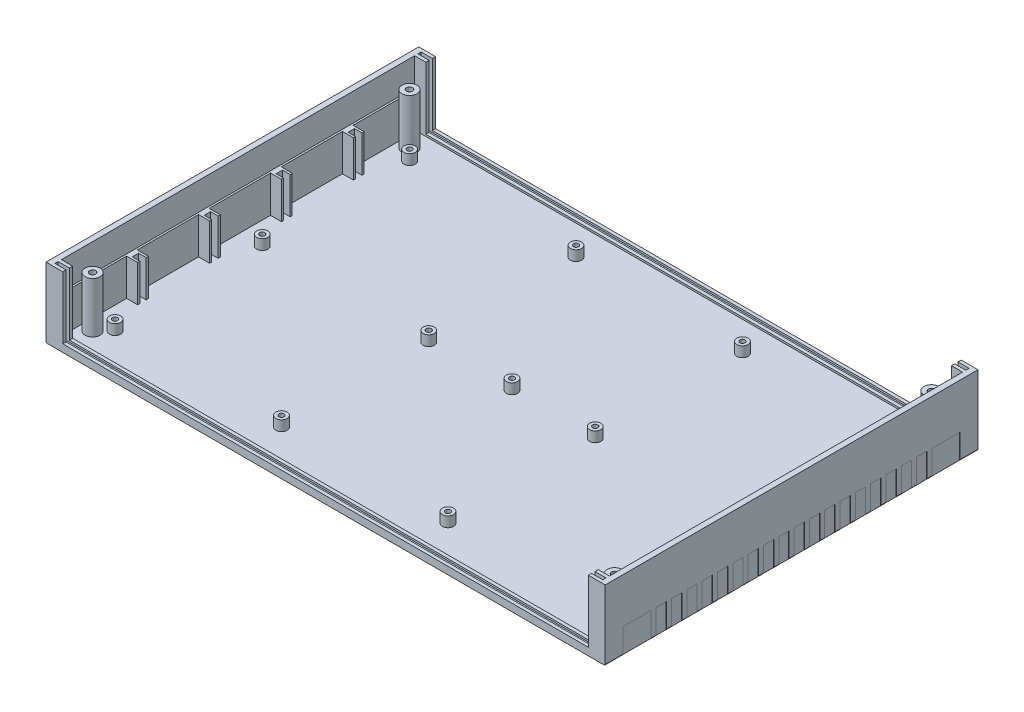
from build123d import *

# Parameters (mm, degrees)
BOSS_EXTRUDE1_DEPTH        = 200
BOSS_EXTRUDE2_DEPTH        = 1.75
BOSS_EXTRUDE3_DEPTH        = 1.75
BOSS_EXTRUDE4_DEPTH        = 19.673598
SKETCH6_R                  = 3
BOSS_EXTRUDE5_DEPTH        = 5.5
SKETCH7_R                  = 4
SKETCH7_R_2                = 1.65
BOSS_EXTRUDE6_DEPTH        = 27.21
SKETCH8_W                  = 5.5555
SKETCH8_H                  = 13.3332
CUT_EXTRUDE1_DEPTH         = 0.2
SKETCH9_W                  = 13.3332
SKETCH9_H                  = 15
SKETCH9_H_2                = 5.5555
CUT_EXTRUDE2_DEPTH         = 0.2
SKETCH10_R                 = 3.143429844
CUT_EXTRUDE3_DEPTH         = 0.2
DOME1_FACE_RADIUS          = 3.143429844
DOME1_HEIGHT               = 2
DOME2_FACE_RADIUS          = 3.143429844
DOME2_HEIGHT               = 2
MIRROR3_COPY_1_FACE_RADIUS = 3.143429844
MIRROR3_COPY_1_HEIGHT      = 2
MIRROR3_COPY_2_FACE_RADIUS = 3.143429844
MIRROR3_COPY_2_HEIGHT      = 2
FILLET1_R                  = 0.6
FILLET2_R                  = 0.6
SKETCH12_W                 = 9
SKETCH12_H                 = 1.75
BOSS_EXTRUDE7_DEPTH        = 34.5
SKETCH13_W                 = 3
SKETCH13_H                 = 200
BOSS_EXTRUDE8_DEPTH        = 19.5


with BuildPart() as part:
    # Sketch1 → Boss-Extrude1 (new body)
    with BuildSketch(Plane.XY):
        Polygon((-159.663258025, 326.785455425), (-161.585000523, 324.985383622), (-161.585000523, 305.311785148), (-171.635000523, 305.311785148), (-173.235000523, 305.311785148), (-176.035000523, 305.311785148), (-177.635000523, 305.311785148), (-183.826313644, 305.311785148), (-260.935000523, 305.311785148), (-262.535000523, 305.311785148), (-265.335000523, 305.311785148), (-266.935000523, 305.311785148), (-305.585000523, 305.311785148), (-307.185000523, 305.311785148), (-309.985000523, 305.311785148), (-311.585000523, 305.311785148), (-350.235000523, 305.311785148), (-351.835000523, 305.311785148), (-354.635000523, 305.311785148), (-356.235000523, 305.311785148), (-439.535000523, 305.311785148), (-441.135000523, 305.311785148), (-443.935000523, 305.311785148), (-445.535000523, 305.311785148), (-455.585000523, 305.311785148), (-455.585000523, 324.985383622), (-457.506743022, 326.785455425), (-458.585000523, 326.353786405), (-458.585000523, 323.212628261), (-458.585000523, 302.311785148), (-158.585000523, 302.311785148), (-158.585000523, 323.212628261), (-158.585000523, 326.353786405), align=None)
    extrude(amount=BOSS_EXTRUDE1_DEPTH)

    # Sketch3 → Boss-Extrude2 (add)
    with BuildSketch(Plane.XY.offset(200)):
        Polygon((-266.935000523, 306.311785148), (-305.585000523, 306.311785148), (-356.235000523, 306.311785148), (-449.585000523, 306.311785148), (-449.585000523, 323.968191865), (-451.320507928, 325.313818993), (-452.793420583, 322.37054613), (-455.585000523, 324.985383622), (-455.585000523, 305.311785148), (-161.585000523, 305.311785148), (-161.585000523, 324.985383622), (-164.376580464, 322.37054613), (-165.849493119, 325.313818993), (-167.585000523, 323.968191865), (-167.585000523, 306.311785148), align=None)
    boss_extrude2 = extrude(amount=-BOSS_EXTRUDE2_DEPTH)

    # Sketch4 → Boss-Extrude3 (add)
    with BuildSketch(Plane(origin=(0, 0, 196.5), x_dir=(-1, 0, 0), z_dir=(0, 0, -1))):
        Polygon((164.376580464, 322.37054613), (161.585000523, 324.985383622), (161.585000523, 305.311785148), (455.585000523, 305.311785148), (455.585000523, 324.985383622), (452.793420583, 322.37054613), (451.320507928, 325.313818993), (449.585000523, 323.968191865), (449.585000523, 306.311785148), (356.235000523, 306.311785148), (305.585000523, 306.311785148), (266.935000523, 306.311785148), (167.585000523, 306.311785148), (167.585000523, 323.968191865), (165.849493119, 325.313818993), align=None)
    boss_extrude3 = extrude(amount=BOSS_EXTRUDE3_DEPTH)

    # Mirror1: Boss-Extrude2, Boss-Extrude3 across plane
    add(boss_extrude2.mirror(Plane.XY.offset(100)))
    add(boss_extrude3.mirror(Plane.XY.offset(100)))

    # Sketch5 → Boss-Extrude4 (add)
    with BuildSketch(Plane(origin=(0, 305.311785148, 0), x_dir=(1, 0, 0), z_dir=(0, 1, 0))):
        Polygon((-161.585000523, -194.75), (-161.585000523, -5.25), (-162.585000523, -5.25), (-162.585000523, -39.239065955), (-162.585000523, -44.960934045), (-162.585000523, -77.839065955), (-162.585000523, -83.560934045), (-162.585000523, -116.439065955), (-162.585000523, -122.160934045), (-162.585000523, -155.039065955), (-162.585000523, -160.760934045), (-162.585000523, -194.75), align=None)
        Polygon((-168.506729499, -122.160934045), (-162.585000523, -122.160934045), (-162.585000523, -116.439065955), (-168.506729499, -116.439065955), (-168.506729499, -117.583605506), (-164.468197004, -117.583605506), (-164.468197004, -121.016394494), (-168.506729499, -121.016394494), align=None)
        Polygon((-162.585000523, -44.960934045), (-162.585000523, -39.239065955), (-168.506729499, -39.239065955), (-168.506729499, -40.383605506), (-164.468197004, -40.383605506), (-164.468197004, -43.816394494), (-168.506729499, -43.816394494), (-168.506729499, -44.960934045), align=None)
        Polygon((-162.585000523, -83.560934045), (-162.585000523, -77.839065955), (-168.506729499, -77.839065955), (-168.506729499, -78.983605506), (-164.468197004, -78.983605506), (-164.468197004, -82.416394494), (-168.506729499, -82.416394494), (-168.506729499, -83.560934045), align=None)
        Polygon((-168.506729499, -160.760934045), (-162.585000523, -160.760934045), (-162.585000523, -155.039065955), (-168.506729499, -155.039065955), (-168.506729499, -156.183605506), (-164.468197004, -156.183605506), (-164.468197004, -159.616394494), (-168.506729499, -159.616394494), align=None)
        Polygon((-454.585000523, -39.239065955), (-454.585000523, -5.25), (-455.585000523, -5.25), (-455.585000523, -194.75), (-454.585000523, -194.75), (-454.585000523, -160.760934045), (-454.585000523, -155.039065955), (-454.585000523, -122.160934045), (-454.585000523, -116.439065955), (-454.585000523, -83.560934045), (-454.585000523, -77.839065955), (-454.585000523, -44.960934045), align=None)
        Polygon((-454.585000523, -155.039065955), (-454.585000523, -160.760934045), (-448.663271548, -160.760934045), (-448.663271548, -159.616394494), (-452.701804043, -159.616394494), (-452.701804043, -156.183605506), (-448.663271548, -156.183605506), (-448.663271548, -155.039065955), align=None)
        Polygon((-454.585000523, -116.439065955), (-454.585000523, -122.160934045), (-448.663271548, -122.160934045), (-448.663271548, -121.016394494), (-452.701804043, -121.016394494), (-452.701804043, -117.583605506), (-448.663271548, -117.583605506), (-448.663271548, -116.439065955), align=None)
        Polygon((-448.663271548, -77.839065955), (-454.585000523, -77.839065955), (-454.585000523, -83.560934045), (-448.663271548, -83.560934045), (-448.663271548, -82.416394494), (-452.701804043, -82.416394494), (-452.701804043, -78.983605506), (-448.663271548, -78.983605506), align=None)
        Polygon((-448.663271548, -39.239065955), (-454.585000523, -39.239065955), (-454.585000523, -44.960934045), (-448.663271548, -44.960934045), (-448.663271548, -43.816394494), (-452.701804043, -43.816394494), (-452.701804043, -40.383605506), (-448.663271548, -40.383605506), align=None)
    extrude(amount=BOSS_EXTRUDE4_DEPTH)

    # Sketch6 → Boss-Extrude5 (add)
    # profile 1 of 13: a face of its own
    with BuildSketch(Plane(origin=(0, 305.311785148, 0), x_dir=(1, 0, 0), z_dir=(0, 1, 0))):
        with Locations(Location((-308.585000523, -100, 0), (0, 0, 90))):
            Circle(SKETCH6_R)
        with BuildLine():
            ThreePointArc((-308.585000523, -98.6), (-307.59505103, -99.010050506), (-307.185000523, -100))
            ThreePointArc((-307.185000523, -100), (-307.59505103, -100.989949494), (-308.585000523, -101.4))
            ThreePointArc((-308.585000523, -101.4), (-309.574950017, -100.989949494), (-309.985000523, -100))
            ThreePointArc((-309.985000523, -100), (-309.574950017, -99.010050506), (-308.585000523, -98.6))
        make_face(mode=Mode.SUBTRACT)
    # profile 2 of 13: a face of its own
    with BuildSketch(Plane(origin=(0, 305.311785148, 0), x_dir=(1, 0, 0), z_dir=(0, 1, 0))):
        with Locations(Location((-174.635000523, -21, 0), (0, 0, 90))):
            Circle(SKETCH6_R)
        with BuildLine():
            ThreePointArc((-174.635000523, -19.6), (-173.64505103, -20.010050506), (-173.235000523, -21))
            ThreePointArc((-173.235000523, -21), (-173.64505103, -21.989949494), (-174.635000523, -22.4))
            ThreePointArc((-174.635000523, -22.4), (-175.624950017, -21.989949494), (-176.035000523, -21))
            ThreePointArc((-176.035000523, -21), (-175.624950017, -20.010050506), (-174.635000523, -19.6))
        make_face(mode=Mode.SUBTRACT)
    # profile 3 of 13: a face of its own
    with BuildSketch(Plane(origin=(0, 305.311785148, 0), x_dir=(1, 0, 0), z_dir=(0, 1, 0))):
        with Locations(Location((-174.635000523, -100, 0), (0, 0, 90))):
            Circle(SKETCH6_R)
        with BuildLine():
            ThreePointArc((-174.635000523, -98.6), (-173.64505103, -99.010050506), (-173.235000523, -100))
            ThreePointArc((-173.235000523, -100), (-173.64505103, -100.989949494), (-174.635000523, -101.4))
            ThreePointArc((-174.635000523, -101.4), (-175.624950017, -100.989949494), (-176.035000523, -100))
            ThreePointArc((-176.035000523, -100), (-175.624950017, -99.010050506), (-174.635000523, -98.6))
        make_face(mode=Mode.SUBTRACT)
    # profile 4 of 13: a face of its own
    with BuildSketch(Plane(origin=(0, 305.311785148, 0), x_dir=(1, 0, 0), z_dir=(0, 1, 0))):
        with Locations(Location((-174.635000523, -179, 0), (0, 0, 90))):
            Circle(SKETCH6_R)
        with BuildLine():
            ThreePointArc((-174.635000523, -177.6), (-173.64505103, -178.010050506), (-173.235000523, -179))
            ThreePointArc((-173.235000523, -179), (-173.64505103, -179.989949494), (-174.635000523, -180.4))
            ThreePointArc((-174.635000523, -180.4), (-175.624950017, -179.989949494), (-176.035000523, -179))
            ThreePointArc((-176.035000523, -179), (-175.624950017, -178.010050506), (-174.635000523, -177.6))
        make_face(mode=Mode.SUBTRACT)
    # profile 5 of 13: a face of its own
    with BuildSketch(Plane(origin=(0, 305.311785148, 0), x_dir=(1, 0, 0), z_dir=(0, 1, 0))):
        with Locations(Location((-263.935000523, -21, 0), (0, 0, 90))):
            Circle(SKETCH6_R)
        with BuildLine():
            ThreePointArc((-263.935000523, -19.6), (-262.94505103, -20.010050506), (-262.535000523, -21))
            ThreePointArc((-262.535000523, -21), (-262.94505103, -21.989949494), (-263.935000523, -22.4))
            ThreePointArc((-263.935000523, -22.4), (-264.924950017, -21.989949494), (-265.335000523, -21))
            ThreePointArc((-265.335000523, -21), (-264.924950017, -20.010050506), (-263.935000523, -19.6))
        make_face(mode=Mode.SUBTRACT)
    # profile 6 of 13: a face of its own
    with BuildSketch(Plane(origin=(0, 305.311785148, 0), x_dir=(1, 0, 0), z_dir=(0, 1, 0))):
        with Locations(Location((-263.935000523, -100, 0), (0, 0, 90))):
            Circle(SKETCH6_R)
        with BuildLine():
            ThreePointArc((-263.935000523, -98.6), (-262.94505103, -99.010050506), (-262.535000523, -100))
            ThreePointArc((-262.535000523, -100), (-262.94505103, -100.989949494), (-263.935000523, -101.4))
            ThreePointArc((-263.935000523, -101.4), (-264.924950017, -100.989949494), (-265.335000523, -100))
            ThreePointArc((-265.335000523, -100), (-264.924950017, -99.010050506), (-263.935000523, -98.6))
        make_face(mode=Mode.SUBTRACT)
    # profile 7 of 13: a face of its own
    with BuildSketch(Plane(origin=(0, 305.311785148, 0), x_dir=(1, 0, 0), z_dir=(0, 1, 0))):
        with Locations(Location((-263.935000523, -179, 0), (0, 0, 90))):
            Circle(SKETCH6_R)
        with BuildLine():
            ThreePointArc((-263.935000523, -177.6), (-262.94505103, -178.010050506), (-262.535000523, -179))
            ThreePointArc((-262.535000523, -179), (-262.94505103, -179.989949494), (-263.935000523, -180.4))
            ThreePointArc((-263.935000523, -180.4), (-264.924950017, -179.989949494), (-265.335000523, -179))
            ThreePointArc((-265.335000523, -179), (-264.924950017, -178.010050506), (-263.935000523, -177.6))
        make_face(mode=Mode.SUBTRACT)
    # profile 8 of 13: a face of its own
    with BuildSketch(Plane(origin=(0, 305.311785148, 0), x_dir=(1, 0, 0), z_dir=(0, 1, 0))):
        with Locations(Location((-353.235000523, -21, 0), (0, 0, 90))):
            Circle(SKETCH6_R)
        with BuildLine():
            ThreePointArc((-353.235000523, -19.6), (-352.24505103, -20.010050506), (-351.835000523, -21))
            ThreePointArc((-351.835000523, -21), (-352.24505103, -21.989949494), (-353.235000523, -22.4))
            ThreePointArc((-353.235000523, -22.4), (-354.224950017, -21.989949494), (-354.635000523, -21))
            ThreePointArc((-354.635000523, -21), (-354.224950017, -20.010050506), (-353.235000523, -19.6))
        make_face(mode=Mode.SUBTRACT)
    # profile 9 of 13: a face of its own
    with BuildSketch(Plane(origin=(0, 305.311785148, 0), x_dir=(1, 0, 0), z_dir=(0, 1, 0))):
        with Locations(Location((-353.235000523, -100, 0), (0, 0, 90))):
            Circle(SKETCH6_R)
        with BuildLine():
            ThreePointArc((-353.235000523, -98.6), (-352.24505103, -99.010050506), (-351.835000523, -100))
            ThreePointArc((-351.835000523, -100), (-352.24505103, -100.989949494), (-353.235000523, -101.4))
            ThreePointArc((-353.235000523, -101.4), (-354.224950017, -100.989949494), (-354.635000523, -100))
            ThreePointArc((-354.635000523, -100), (-354.224950017, -99.010050506), (-353.235000523, -98.6))
        make_face(mode=Mode.SUBTRACT)
    # profile 10 of 13: a face of its own
    with BuildSketch(Plane(origin=(0, 305.311785148, 0), x_dir=(1, 0, 0), z_dir=(0, 1, 0))):
        with Locations(Location((-353.235000523, -179, 0), (0, 0, 90))):
            Circle(SKETCH6_R)
        with BuildLine():
            ThreePointArc((-353.235000523, -177.6), (-352.24505103, -178.010050506), (-351.835000523, -179))
            ThreePointArc((-351.835000523, -179), (-352.24505103, -179.989949494), (-353.235000523, -180.4))
            ThreePointArc((-353.235000523, -180.4), (-354.224950017, -179.989949494), (-354.635000523, -179))
            ThreePointArc((-354.635000523, -179), (-354.224950017, -178.010050506), (-353.235000523, -177.6))
        make_face(mode=Mode.SUBTRACT)
    # profile 11 of 13: a face of its own
    with BuildSketch(Plane(origin=(0, 305.311785148, 0), x_dir=(1, 0, 0), z_dir=(0, 1, 0))):
        with Locations(Location((-442.535000523, -21, 0), (0, 0, 90))):
            Circle(SKETCH6_R)
        with BuildLine():
            ThreePointArc((-442.535000523, -19.6), (-441.54505103, -20.010050506), (-441.135000523, -21))
            ThreePointArc((-441.135000523, -21), (-441.54505103, -21.989949494), (-442.535000523, -22.4))
            ThreePointArc((-442.535000523, -22.4), (-443.524950017, -21.989949494), (-443.935000523, -21))
            ThreePointArc((-443.935000523, -21), (-443.524950017, -20.010050506), (-442.535000523, -19.6))
        make_face(mode=Mode.SUBTRACT)
    # profile 12 of 13: a face of its own
    with BuildSketch(Plane(origin=(0, 305.311785148, 0), x_dir=(1, 0, 0), z_dir=(0, 1, 0))):
        with Locations(Location((-442.535000523, -100, 0), (0, 0, 90))):
            Circle(SKETCH6_R)
        with BuildLine():
            ThreePointArc((-442.535000523, -98.6), (-441.54505103, -99.010050506), (-441.135000523, -100))
            ThreePointArc((-441.135000523, -100), (-441.54505103, -100.989949494), (-442.535000523, -101.4))
            ThreePointArc((-442.535000523, -101.4), (-443.524950017, -100.989949494), (-443.935000523, -100))
            ThreePointArc((-443.935000523, -100), (-443.524950017, -99.010050506), (-442.535000523, -98.6))
        make_face(mode=Mode.SUBTRACT)
    # profile 13 of 13: a face of its own
    with BuildSketch(Plane(origin=(0, 305.311785148, 0), x_dir=(1, 0, 0), z_dir=(0, 1, 0))):
        with Locations(Location((-442.535000523, -179, 0), (0, 0, 90))):
            Circle(SKETCH6_R)
        with BuildLine():
            ThreePointArc((-442.535000523, -177.6), (-441.54505103, -178.010050506), (-441.135000523, -179))
            ThreePointArc((-441.135000523, -179), (-441.54505103, -179.989949494), (-442.535000523, -180.4))
            ThreePointArc((-442.535000523, -180.4), (-443.524950017, -179.989949494), (-443.935000523, -179))
            ThreePointArc((-443.935000523, -179), (-443.524950017, -178.010050506), (-442.535000523, -177.6))
        make_face(mode=Mode.SUBTRACT)
    extrude(amount=BOSS_EXTRUDE5_DEPTH)

    # Sketch7 → Boss-Extrude6 (add)
    # profile 1 of 4: a face of its own
    with BuildSketch(Plane(origin=(0, 305.311785148, 0), x_dir=(1, 0, 0), z_dir=(0, 1, 0))):
        with Locations(Location((-448.585000523, -185.000000001, 0), (0, 0, 90))):
            Circle(SKETCH7_R)
        with Locations(Location((-448.585000523, -185.000000001, 0), (0, 0, 270))):
            Circle(SKETCH7_R_2, mode=Mode.SUBTRACT)
    # profile 2 of 4: a face of its own
    with BuildSketch(Plane(origin=(0, 305.311785148, 0), x_dir=(1, 0, 0), z_dir=(0, 1, 0))):
        with Locations(Location((-168.585000523, -185.000000001, 0), (0, 0, 90))):
            Circle(SKETCH7_R)
        with Locations(Location((-168.585000523, -185.000000001, 0), (0, 0, 270))):
            Circle(SKETCH7_R_2, mode=Mode.SUBTRACT)
    # profile 3 of 4: a face of its own
    with BuildSketch(Plane(origin=(0, 305.311785148, 0), x_dir=(1, 0, 0), z_dir=(0, 1, 0))):
        with Locations(Location((-168.585000523, -14.999999999, 0), (0, 0, 90))):
            Circle(SKETCH7_R)
        with Locations(Location((-168.585000523, -14.999999999, 0), (0, 0, 270))):
            Circle(SKETCH7_R_2, mode=Mode.SUBTRACT)
    # profile 4 of 4: a face of its own
    with BuildSketch(Plane(origin=(0, 305.311785148, 0), x_dir=(1, 0, 0), z_dir=(0, 1, 0))):
        with Locations(Location((-448.585000523, -14.999999999, 0), (0, 0, 90))):
            Circle(SKETCH7_R)
        with Locations(Location((-448.585000523, -14.999999999, 0), (0, 0, 270))):
            Circle(SKETCH7_R_2, mode=Mode.SUBTRACT)
    extrude(amount=BOSS_EXTRUDE6_DEPTH)

    # Sketch8 → Cut-Extrude1 (cut)
    with BuildSketch(Plane(origin=(-158.585000523, 0, 0), x_dir=(0, 0, -1), z_dir=(1, 0, 0))):
        with Locations((-30.11081, 308.978385148)):
            Rectangle(SKETCH8_W, SKETCH8_H)
        with Locations((-38.33295, 308.978385148)):
            Rectangle(SKETCH8_W, SKETCH8_H)
        with Locations((-46.55509, 308.978385148)):
            Rectangle(SKETCH8_W, SKETCH8_H)
        with Locations((-54.77723, 308.978385148)):
            Rectangle(SKETCH8_W, SKETCH8_H)
        with Locations((-62.99937, 308.978385148)):
            Rectangle(SKETCH8_W, SKETCH8_H)
        with Locations((-71.22151, 308.978385148)):
            Rectangle(SKETCH8_W, SKETCH8_H)
        with Locations((-79.44365, 308.978385148)):
            Rectangle(SKETCH8_W, SKETCH8_H)
        with Locations((-87.66579, 308.978385148)):
            Rectangle(SKETCH8_W, SKETCH8_H)
        with Locations((-95.88793, 308.978385148)):
            Rectangle(SKETCH8_W, SKETCH8_H)
        with Locations((-104.11007, 308.978385148)):
            Rectangle(SKETCH8_W, SKETCH8_H)
        with Locations((-112.33221, 308.978385148)):
            Rectangle(SKETCH8_W, SKETCH8_H)
        with Locations((-120.55435, 308.978385148)):
            Rectangle(SKETCH8_W, SKETCH8_H)
        with Locations((-128.77649, 308.978385148)):
            Rectangle(SKETCH8_W, SKETCH8_H)
        Polygon((-190.33694, 315.644985148), (-190.33694, 302.311785148), (-181.55374, 302.311785148), (-175.33694, 302.311785148), (-175.33694, 315.644985148), align=None)
        with Locations((-169.88719, 308.978385148)):
            Rectangle(SKETCH8_W, SKETCH8_H)
        with Locations((-161.66505, 308.978385148)):
            Rectangle(SKETCH8_W, SKETCH8_H)
        with Locations((-153.44291, 308.978385148)):
            Rectangle(SKETCH8_W, SKETCH8_H)
        with Locations((-145.22077, 308.978385148)):
            Rectangle(SKETCH8_W, SKETCH8_H)
        with Locations((-136.99863, 308.978385148)):
            Rectangle(SKETCH8_W, SKETCH8_H)
        Polygon((-24.66306, 315.644985148), (-24.66306, 302.311785148), (-18.44426, 302.311785148), (-9.66306, 302.311785148), (-9.66306, 315.644985148), align=None)
    cut_extrude1 = extrude(amount=-CUT_EXTRUDE1_DEPTH, mode=Mode.SUBTRACT)

    # Sketch9 → Cut-Extrude2 (cut)
    with BuildSketch(Plane.XZ.offset(-302.311785148)):
        with Locations((-165.251600523, 182.83694)):
            Rectangle(SKETCH9_W, SKETCH9_H)
        with Locations((-165.251600523, 169.88919)):
            Rectangle(SKETCH9_W, SKETCH9_H_2)
        with Locations((-165.251600523, 161.66705)):
            Rectangle(SKETCH9_W, SKETCH9_H_2)
        with Locations((-165.251600523, 153.44491)):
            Rectangle(SKETCH9_W, SKETCH9_H_2)
        with Locations((-165.251600523, 145.22277)):
            Rectangle(SKETCH9_W, SKETCH9_H_2)
        with Locations((-165.251600523, 137.00063)):
            Rectangle(SKETCH9_W, SKETCH9_H_2)
        with Locations((-165.251600523, 128.77849)):
            Rectangle(SKETCH9_W, SKETCH9_H_2)
        with Locations((-165.251600523, 120.55635)):
            Rectangle(SKETCH9_W, SKETCH9_H_2)
        with Locations((-165.251600523, 112.33421)):
            Rectangle(SKETCH9_W, SKETCH9_H_2)
        with Locations((-165.251600523, 104.11207)):
            Rectangle(SKETCH9_W, SKETCH9_H_2)
        with Locations((-165.251600523, 95.88993)):
            Rectangle(SKETCH9_W, SKETCH9_H_2)
        with Locations((-165.251600523, 87.66779)):
            Rectangle(SKETCH9_W, SKETCH9_H_2)
        with Locations((-165.251600523, 79.44565)):
            Rectangle(SKETCH9_W, SKETCH9_H_2)
        with Locations((-165.251600523, 71.22351)):
            Rectangle(SKETCH9_W, SKETCH9_H_2)
        with Locations((-165.251600523, 63.00137)):
            Rectangle(SKETCH9_W, SKETCH9_H_2)
        with Locations((-165.251600523, 54.77923)):
            Rectangle(SKETCH9_W, SKETCH9_H_2)
        with Locations((-165.251600523, 46.55709)):
            Rectangle(SKETCH9_W, SKETCH9_H_2)
        with Locations((-165.251600523, 38.33495)):
            Rectangle(SKETCH9_W, SKETCH9_H_2)
        with Locations((-165.251600523, 30.11281)):
            Rectangle(SKETCH9_W, SKETCH9_H_2)
        with Locations((-165.251600523, 17.16306)):
            Rectangle(SKETCH9_W, SKETCH9_H)
    cut_extrude2 = extrude(amount=-CUT_EXTRUDE2_DEPTH, mode=Mode.SUBTRACT)

    # Sketch10 → Cut-Extrude3 (cut)
    with BuildSketch(Plane.XZ.offset(-302.511785148)):
        with Locations(Location((-165.351600523, 182.83694, 0), (0, 0, 270))):
            Circle(SKETCH10_R)
        with Locations(Location((-165.351600523, 17.16306, 0), (0, 0, 90))):
            Circle(SKETCH10_R)
    cut_extrude3 = extrude(amount=-CUT_EXTRUDE3_DEPTH, mode=Mode.SUBTRACT)

    # Dome1: a dome of height H over a round flat face of radius A is a cap of a sphere of radius (A * A + H * H) / (2 * H)
    dome1_r = (DOME1_FACE_RADIUS * DOME1_FACE_RADIUS + DOME1_HEIGHT * DOME1_HEIGHT) / (2 * DOME1_HEIGHT)
    dome1_base = Plane((-165.351600523, 302.711785148, 182.83694), z_dir=(0, -1, 0))
    with Locations(dome1_base.offset(DOME1_HEIGHT - dome1_r)):
        dome1_ball = Sphere(dome1_r, mode=Mode.PRIVATE)
    add(split(dome1_ball, bisect_by=dome1_base, keep=Keep.TOP, mode=Mode.PRIVATE))

    # Dome2: a dome of height H over a round flat face of radius A is a cap of a sphere of radius (A * A + H * H) / (2 * H)
    dome2_r = (DOME2_FACE_RADIUS * DOME2_FACE_RADIUS + DOME2_HEIGHT * DOME2_HEIGHT) / (2 * DOME2_HEIGHT)
    dome2_base = Plane((-165.351600523, 302.711785148, 17.16306), z_dir=(0, -1, 0))
    with Locations(dome2_base.offset(DOME2_HEIGHT - dome2_r)):
        dome2_ball = Sphere(dome2_r, mode=Mode.PRIVATE)
    add(split(dome2_ball, bisect_by=dome2_base, keep=Keep.TOP, mode=Mode.PRIVATE))

    # Mirror3: Cut-Extrude1, Cut-Extrude2, Cut-Extrude3 across plane
    add(cut_extrude1.mirror(Plane(origin=(-308.585000523, 0, 0), x_dir=(0, 0, 1), z_dir=(1, 0, 0))), mode=Mode.SUBTRACT)
    add(cut_extrude2.mirror(Plane(origin=(-308.585000523, 0, 0), x_dir=(0, 0, 1), z_dir=(1, 0, 0))), mode=Mode.SUBTRACT)
    add(cut_extrude3.mirror(Plane(origin=(-308.585000523, 0, 0), x_dir=(0, 0, 1), z_dir=(1, 0, 0))), mode=Mode.SUBTRACT)

    # Mirror3 copy 1: a dome of height H over a round flat face of radius A is a cap of a sphere of radius (A * A + H * H) / (2 * H)
    mirror3_copy_1_r = (MIRROR3_COPY_1_FACE_RADIUS * MIRROR3_COPY_1_FACE_RADIUS + MIRROR3_COPY_1_HEIGHT * MIRROR3_COPY_1_HEIGHT) / (2 * MIRROR3_COPY_1_HEIGHT)
    mirror3_copy_1_base = Plane((-451.818400524, 302.711785148, 182.83694), z_dir=(0, -1, 0))
    with Locations(mirror3_copy_1_base.offset(MIRROR3_COPY_1_HEIGHT - mirror3_copy_1_r)):
        mirror3_copy_1_ball = Sphere(mirror3_copy_1_r, mode=Mode.PRIVATE)
    add(split(mirror3_copy_1_ball, bisect_by=mirror3_copy_1_base, keep=Keep.TOP, mode=Mode.PRIVATE))

    # Mirror3 copy 2: a dome of height H over a round flat face of radius A is a cap of a sphere of radius (A * A + H * H) / (2 * H)
    mirror3_copy_2_r = (MIRROR3_COPY_2_FACE_RADIUS * MIRROR3_COPY_2_FACE_RADIUS + MIRROR3_COPY_2_HEIGHT * MIRROR3_COPY_2_HEIGHT) / (2 * MIRROR3_COPY_2_HEIGHT)
    mirror3_copy_2_base = Plane((-451.818400524, 302.711785148, 17.16306), z_dir=(0, -1, 0))
    with Locations(mirror3_copy_2_base.offset(MIRROR3_COPY_2_HEIGHT - mirror3_copy_2_r)):
        mirror3_copy_2_ball = Sphere(mirror3_copy_2_r, mode=Mode.PRIVATE)
    add(split(mirror3_copy_2_ball, bisect_by=mirror3_copy_2_base, keep=Keep.TOP, mode=Mode.PRIVATE))

    # Fillet1
    fillet1_edges = [part.edges().sort_by_distance(p)[0] for p in [
        (-458.585000523, 302.311785148, 83.55572),
        (-458.585000523, 302.311785148, 91.77786),
        (-458.585000523, 302.311785148, 100),
        (-458.585000523, 302.311785148, 108.22214),
        (-458.585000523, 302.311785148, 116.44428),
        (-458.585000523, 302.311785148, 124.66642),
        (-458.585000523, 302.311785148, 132.88856),
        (-458.585000523, 302.311785148, 141.1107),
        (-458.585000523, 302.311785148, 149.33284),
        (-458.585000523, 302.311785148, 157.55498),
        (-458.585000523, 302.311785148, 165.77712),
        (-458.585000523, 302.311785148, 174.00194),
        (-458.585000523, 302.311785148, 195.16847),
        (-458.585000523, 302.311785148, 75.33358),
        (-458.585000523, 302.311785148, 67.11144),
        (-458.585000523, 302.311785148, 58.8893),
        (-458.585000523, 302.311785148, 50.66716),
        (-458.585000523, 302.311785148, 42.44502),
        (-458.585000523, 302.311785148, 34.22288),
        (-458.585000523, 302.311785148, 25.99806),
        (-458.585000523, 302.311785148, 4.83153),
    ]]
    fillet(fillet1_edges, radius=FILLET1_R)

    # Fillet2
    fillet2_edges = [part.edges().sort_by_distance(p)[0] for p in [
        (-158.585000523, 302.311785148, 4.83153),
        (-158.585000523, 302.311785148, 25.99806),
        (-158.585000523, 302.311785148, 34.22288),
        (-158.585000523, 302.311785148, 42.44502),
        (-158.585000523, 302.311785148, 50.66716),
        (-158.585000523, 302.311785148, 58.8893),
        (-158.585000523, 302.311785148, 67.11144),
        (-158.585000523, 302.311785148, 75.33358),
        (-158.585000523, 302.311785148, 83.55572),
        (-158.585000523, 302.311785148, 91.77786),
        (-158.585000523, 302.311785148, 100),
        (-158.585000523, 302.311785148, 108.22214),
        (-158.585000523, 302.311785148, 116.44428),
        (-158.585000523, 302.311785148, 124.66642),
        (-158.585000523, 302.311785148, 132.88856),
        (-158.585000523, 302.311785148, 141.1107),
        (-158.585000523, 302.311785148, 149.33284),
        (-158.585000523, 302.311785148, 157.55498),
        (-158.585000523, 302.311785148, 165.77712),
        (-158.585000523, 302.311785148, 174.00194),
        (-158.585000523, 302.311785148, 195.16847),
    ]]
    fillet(fillet2_edges, radius=FILLET2_R)

    # Sketch12 → Boss-Extrude7 (add)
    with BuildSketch(Plane(origin=(0, 305.311785148, 0), x_dir=(1, 0, 0), z_dir=(0, 1, 0))):
        with Locations((-163.085000523, -0.875)):
            Rectangle(SKETCH12_W, SKETCH12_H)
        with Locations((-163.085000523, -4.375)):
            Rectangle(SKETCH12_W, SKETCH12_H)
        with Locations((-163.085000523, -195.625)):
            Rectangle(SKETCH12_W, SKETCH12_H)
        with Locations((-163.085000523, -199.125)):
            Rectangle(SKETCH12_W, SKETCH12_H)
        with Locations((-454.085000523, -199.125)):
            Rectangle(SKETCH12_W, SKETCH12_H)
        with Locations((-454.085000523, -195.625)):
            Rectangle(SKETCH12_W, SKETCH12_H)
        with Locations((-454.085000523, -4.375)):
            Rectangle(SKETCH12_W, SKETCH12_H)
        with Locations((-454.085000523, -0.875)):
            Rectangle(SKETCH12_W, SKETCH12_H)
    extrude(amount=BOSS_EXTRUDE7_DEPTH)

    # Sketch13 → Boss-Extrude8 (add)
    with BuildSketch(Plane(origin=(0, 339.811785148, 0), x_dir=(1, 0, 0), z_dir=(0, 1, 0))):
        with Locations((-160.085000523, -100)):
            Rectangle(SKETCH13_W, SKETCH13_H)
        with Locations((-457.085000523, -100)):
            Rectangle(SKETCH13_W, SKETCH13_H)
    extrude(amount=-BOSS_EXTRUDE8_DEPTH)


solid = part.part
